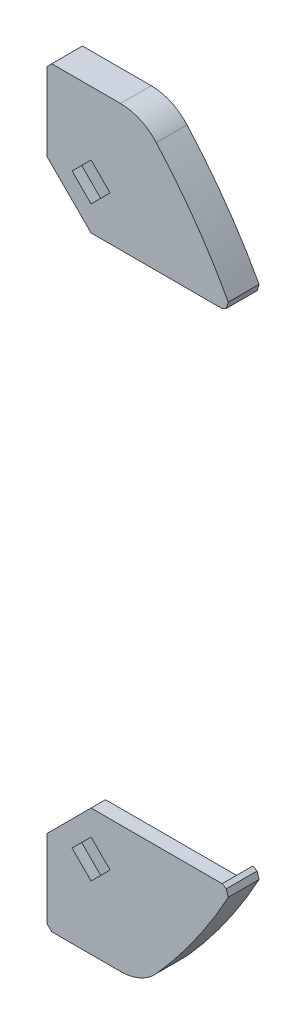
from build123d import *

# Parameters (mm, degrees)
SKETCH1_R           = 1.5
BOSS_EXTRUDE1_DEPTH = 3
BOSS_EXTRUDE2_START = 3.4
BOSS_EXTRUDE2_DEPTH = 3.4
CUT_EXTRUDE1_START  = -2
CUT_EXTRUDE1_DEPTH  = 2
FILLET1_R           = 10
CHAMFER1_SIZE       = 1
BOSS_EXTRUDE3_START = -0.2
SKETCH4_R           = 1.5
BOSS_EXTRUDE3_DEPTH = 0.2


with BuildPart() as part:
    # Sketch1 → Boss-Extrude1 (new body)
    with BuildSketch(Plane.XY):
        with BuildLine():
            Line((328.691338583, 341.56036775), (355.953928282, 341.56036775))
            Line((355.953928282, 341.56036775), (357.719129547, 342.500614789))
            ThreePointArc((357.719129547, 342.500614789), (349.332397931, 355.881708416), (339.150023633, 367.952755906))
            Line((339.150023633, 367.952755906), (319.498950427, 367.952755906))
            Line((319.498950427, 367.952755906), (319.498950427, 350.752755906))
            Line((319.498950427, 350.752755906), (328.691338583, 341.56036775))
        make_face()
        with Locations(Location((328.691338583, 350.752755906, 0), (0, 0, 270))):
            Circle(SKETCH1_R, mode=Mode.SUBTRACT)
    extrude(amount=BOSS_EXTRUDE1_DEPTH)

    # Sketch2 → Boss-Extrude2 (add)
    with BuildSketch(Plane(origin=(0, 0, 0), x_dir=(-1, 0, 0), z_dir=(0, 0, -1)).offset(BOSS_EXTRUDE2_START)):
        with BuildLine():
            Line((-319.498950427, 367.952755906), (-339.150023633, 367.952755906))
            ThreePointArc((-339.150023633, 367.952755906), (-349.332397931, 355.881708416), (-357.719129547, 342.500614789))
            Line((-357.719129547, 342.500614789), (-355.953928282, 341.56036775))
            ThreePointArc((-355.953928282, 341.56036775), (-347.964183921, 354.362345636), (-338.300383295, 365.952755906))
            Line((-338.300383295, 365.952755906), (-319.498950427, 365.952755906))
            Line((-319.498950427, 365.952755906), (-319.498950427, 367.952755906))
        make_face()
    extrude(amount=-BOSS_EXTRUDE2_DEPTH)

    # Sketch3 → Cut-Extrude1 (cut)
    with BuildSketch(Plane.XY.offset(3).offset(CUT_EXTRUDE1_START)):
        Polygon((332.651136557, 350.752755906), (328.691338583, 346.792957931), (324.731540608, 350.752755906), (328.691338583, 354.71255388), align=None)
    extrude(amount=CUT_EXTRUDE1_DEPTH, mode=Mode.SUBTRACT)

    # Fillet1
    fillet1_edges = [part.edges().sort_by_distance(p)[0] for p in [
        (339.150023633, 367.952755906, -0.2),
    ]]
    fillet(fillet1_edges, radius=FILLET1_R)

    # Chamfer1
    # the kernel refuses this chamfer: 1 mm, written as the material it takes off along each edge
    with BuildSketch(Plane(origin=(319.498950427, 367.952755906, 5.571682988), x_dir=(1, 0, 0), z_dir=(0, 0, -1))) as chamfer1_piece_1:
        Polygon((CHAMFER1_SIZE, 0), (0, CHAMFER1_SIZE), (0, 0), align=None)
    extrude(amount=11.543365976, mode=Mode.SUBTRACT)
    with BuildSketch(Plane(origin=(357.719129547, 342.500614789, -5.971682988), x_dir=(-0.4740347155917083, 0.8805061546712143, 7.820465649921131e-15), z_dir=(0, 0, 1))) as chamfer1_piece_2:
        with BuildLine():
            Line((0.995592665, 0), (CHAMFER1_SIZE * 0.00443668745667, CHAMFER1_SIZE * 0.999990157854))
            Line((CHAMFER1_SIZE * 0.00443668745667, CHAMFER1_SIZE * 0.999990157854), (0, 0))
            ThreePointArc((0, 0), (0.511873941, -0.001103406), (0.995592665, 0))
        make_face()
    extrude(amount=11.543365976, mode=Mode.SUBTRACT)


with BuildPart() as body_2:
    # Mirror2: mirrored copy
    add(part.part.mirror(Plane.ZX.offset(289.752755906)))


with BuildPart() as part_1:
    add(part.part)

    add(body_2.part)  # Boss-Extrude3 merges body 2
    # Sketch4 → Boss-Extrude3 (add)
    with BuildSketch(Plane.XY.offset(1).offset(BOSS_EXTRUDE3_START)):
        with Locations((328.691338583, 350.752755906)):
            Circle(SKETCH4_R)
        with Locations((328.691338583, 228.752755906)):
            Circle(SKETCH4_R)
    extrude(amount=BOSS_EXTRUDE3_DEPTH)


solid = part_1.part
